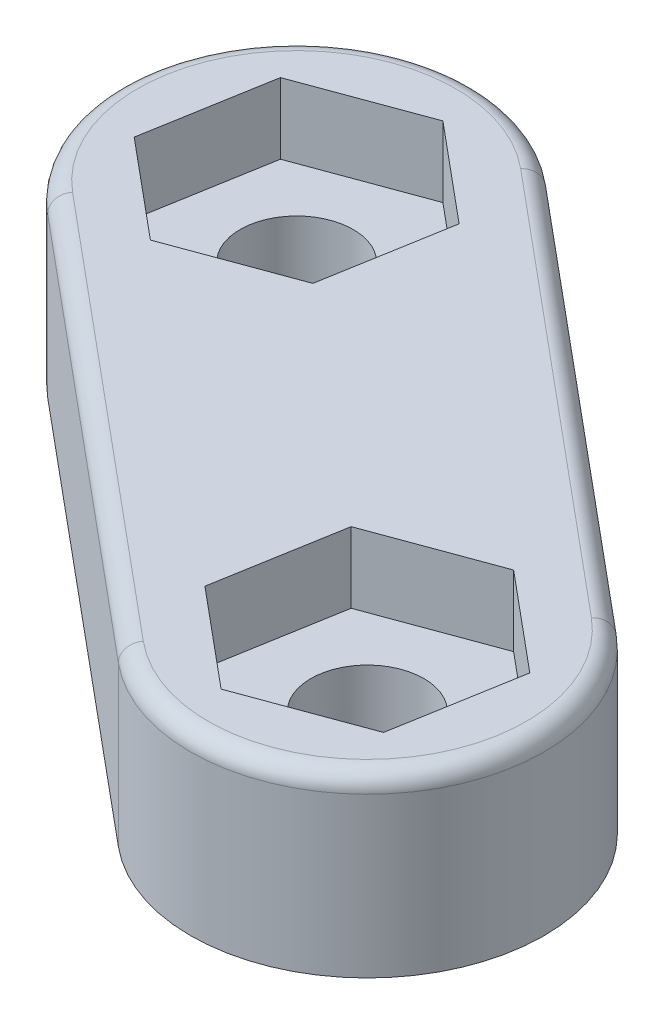
from build123d import *

# Parameters (mm, degrees)
SKETCH1_R           = 1.6
BOSS_EXTRUDE1_DEPTH = 5
CUT_EXTRUDE1_DEPTH  = 2
FILLET1_R           = 0.5


with BuildPart() as part:
    # Sketch1 → Boss-Extrude1 (new body)
    with BuildSketch(Plane(origin=(0, 0, 0), x_dir=(1, 0, 0), z_dir=(0, 1, 0))):
        with BuildLine():
            Line((-9.200921998, 1.158893602), (2.799078002, -8.841106398))
            ThreePointArc((2.799078002, -8.841106398), (9.841106398, -8.200921998), (9.200921998, -1.158893602))
            Line((9.200921998, -1.158893602), (-2.799078002, 8.841106398))
            ThreePointArc((-2.799078002, 8.841106398), (-9.841106398, 8.200921998), (-9.200921998, 1.158893602))
        make_face()
        with Locations((-6, 5)):
            Circle(SKETCH1_R, mode=Mode.SUBTRACT)
        with Locations((6, -5)):
            Circle(SKETCH1_R, mode=Mode.SUBTRACT)
    extrude(amount=BOSS_EXTRUDE1_DEPTH)

    # Sketch2 → Cut-Extrude1 (cut)
    with BuildSketch(Plane(origin=(0, 5, 0), x_dir=(1, 0, 0), z_dir=(0, 1, 0))):
        Polygon((-8.749903128, 7.29158594), (-9.359523203, 3.764307003), (-6.609620075, 1.472721063), (-3.250096872, 2.70841406), (-2.640476797, 6.235692997), (-5.390379925, 8.527278937), align=None)
        Polygon((5.390379925, -8.527278937), (2.640476797, -6.235692997), (3.250096872, -2.70841406), (6.609620075, -1.472721063), (9.359523203, -3.764307003), (8.749903128, -7.29158594), align=None)
    extrude(amount=-CUT_EXTRUDE1_DEPTH, mode=Mode.SUBTRACT)

    # Fillet1
    fillet1_edges = [part.edges().sort_by_distance(p)[0] for p in [
        (-9.841106398, 5, -8.200921998),
        (3.200921998, 5, -3.841106398),
        (9.841106398, 5, 8.200921998),
        (-3.200921998, 5, 3.841106398),
    ]]
    fillet(fillet1_edges, radius=FILLET1_R)


solid = part.part
